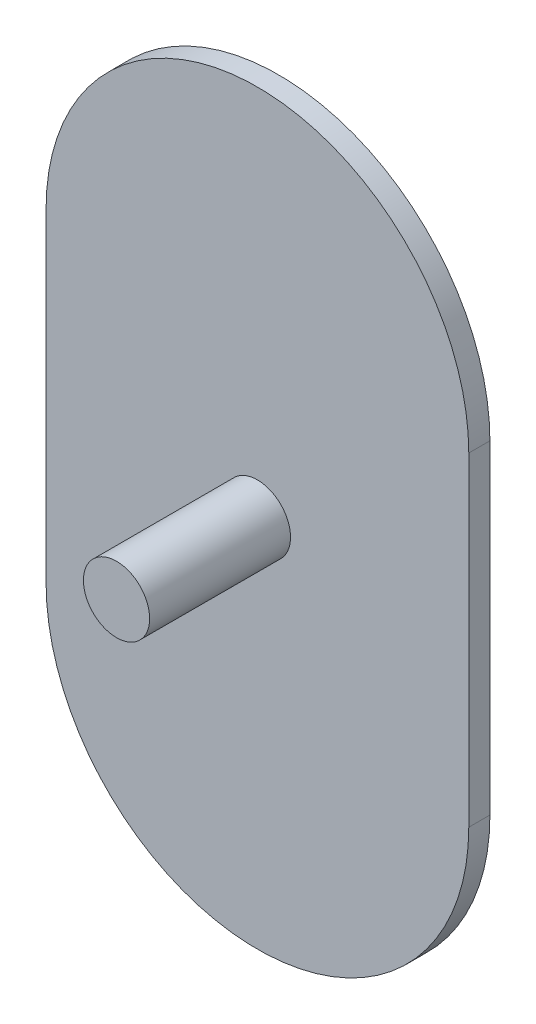
from build123d import *

# Parameters (mm, degrees)
DODANIE_WYCI_GNI_CIE2_DEPTH = 1.5
SZKIC37_R                   = 1.85
DODANIE_WYCI_GNI_CIE3_DEPTH = 1.5
SZKIC38_R                   = 3.85
DODANIE_WYCI_GNI_CIE4_DEPTH = 1.7
ZAOKR_GLENIE1_R             = 2
SZKIC39_R                   = 2.35
DODANIE_WYCI_GNI_CIE5_DEPTH = 10


with BuildPart() as part:
    # Szkic35 → Dodanie-wyciągnięcie2 (new body)
    with BuildSketch(Plane.XY):
        with BuildLine():
            Line((-15, -11.5), (-15, 11.5))
            ThreePointArc((-15, 11.5), (0, 26.5), (15, 11.5))
            Line((15, 11.5), (15, -11.5))
            ThreePointArc((15, -11.5), (0, -26.5), (-15, -11.5))
        make_face()
    extrude(amount=DODANIE_WYCI_GNI_CIE2_DEPTH)

    # Szkic37 → Dodanie-wyciągnięcie3 (add)
    with BuildSketch(Plane(origin=(0, 0, 0), x_dir=(-1, 0, 0), z_dir=(0, 0, -1))):
        with Locations((0, 12.5)):
            Circle(SZKIC37_R)
        with Locations((0, -12.5)):
            Circle(SZKIC37_R)
    extrude(amount=DODANIE_WYCI_GNI_CIE3_DEPTH)

    # Szkic38 → Dodanie-wyciągnięcie4 (add)
    with BuildSketch(Plane(origin=(0, 0, -1.5), x_dir=(-1, 0, 0), z_dir=(0, 0, -1))):
        with Locations((0, 12.5)):
            Circle(SZKIC38_R)
        with Locations((0, -12.5)):
            Circle(SZKIC38_R)
    extrude(amount=DODANIE_WYCI_GNI_CIE4_DEPTH)

    # Zaokrąglenie1
    # the kernel refuses this fillet: 2 mm, written as the material it takes off along each edge
    with BuildSketch(Plane(origin=(0, 12.5, -3.2), x_dir=(-1, 0, 0), z_dir=(0, -1, 0))) as zaokr_glenie1_piece_1:
        with BuildLine():
            CenterArc((1.872628007, -2), ZAOKR_GLENIE1_R, 8.626926559, 81.373073441)
            Line((1.872628007, 0), (1.872628007, 0.04))
            Line((1.872628007, 0.04), (3.85, 0.04))
            Line((3.85, 0.04), (3.89, 0))
            ThreePointArc((3.89, 0), (3.89, -0.85), (3.88954744, -1.694))
            Line((3.88954744, -1.694), (3.85, -1.7))
        make_face()
    revolve(axis=Axis((0, 12.5, -3.2), (0, 0, -1)), mode=Mode.SUBTRACT)
    with BuildSketch(Plane(origin=(0, -12.5, -3.2), x_dir=(-1, 0, 0), z_dir=(0, -1, 0))) as zaokr_glenie1_piece_2:
        with BuildLine():
            CenterArc((1.872628007, -2), ZAOKR_GLENIE1_R, 8.626926559, 81.373073441)
            Line((1.872628007, 0), (1.872628007, 0.04))
            Line((1.872628007, 0.04), (3.85, 0.04))
            Line((3.85, 0.04), (3.89, 0))
            ThreePointArc((3.89, 0), (3.89, -0.85), (3.88954744, -1.694))
            Line((3.88954744, -1.694), (3.85, -1.7))
        make_face()
    revolve(axis=Axis((0, -12.5, -3.2), (0, 0, -1)), mode=Mode.SUBTRACT)

    # Szkic39 → Dodanie-wyciągnięcie5 (add)
    with BuildSketch(Plane.XY.offset(1.5)):
        with Locations(Location((0, 0, 0), (0, 0, 180))):
            Circle(SZKIC39_R)
    extrude(amount=DODANIE_WYCI_GNI_CIE5_DEPTH)


solid = part.part
